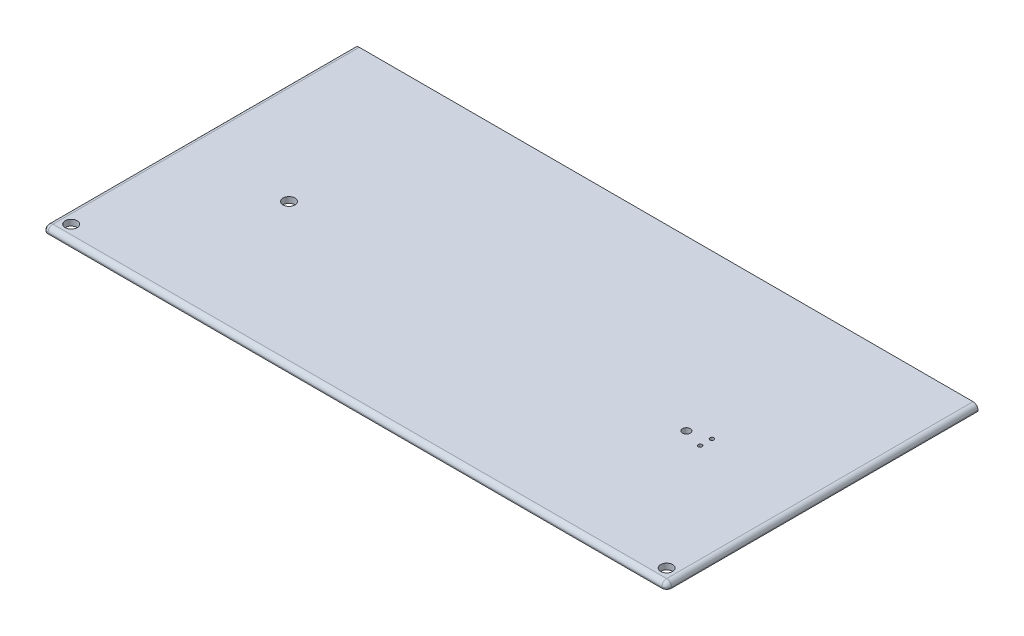
from build123d import *

# Parameters (mm, degrees)
BOSS_EXTRUDE1_DEPTH      = 1.25
SKETCH1_W                = 156
SKETCH1_H                = 69.5
BOSS_EXTRUDE2_DEPTH      = 105
SKETCH4_R                = 2.5000000000000027
BOSS_EXTRUDE3_DEPTH      = 8
FILLET2_R                = 2
SKETCH5_R                = 1.5499999999999998
SKETCH5_R_2              = 1.5500000000000012
CUT_EXTRUDE1_DEPTH       = 8
SKETCH6_R                = 8.25
CUT_EXTRUDE2_DEPTH       = 8
SKETCH8_R                = 3.750000000000007
SKETCH8_R_2              = 3.0000000000000084
SKETCH8_W                = 7.000000000000014
SKETCH8_H                = 14
CUT_EXTRUDE3_DEPTH       = 8
FILLET3_R                = 1.25
FILLET4_R                = 1.25
SKETCH11_R               = 1.5499999999999932
CUT_EXTRUDE4_DEPTH       = 8
BOSS_EXTRUDE5_REACH      = 209.004
FILLET5_R                = 1.25
SKETCH14_R               = 1.5249999999999995
CUT_EXTRUDE5_DEPTH       = 8
BOSS_EXTRUDE6_DEPTH      = 5
CUT_EXTRUDE10_DEPTH      = 176.50000000000017
CUT_EXTRUDE10_DEPTH_BACK = 9
SKETCH19_R               = 1.5249999999999995
BOSS_EXTRUDE7_DEPTH      = 1.5
SKETCH17_W               = 214.39373035957487
SKETCH17_H               = 311.75060194691184
CUT_EXTRUDE6_DEPTH       = 142.50000000000003
SKETCH18_W               = 843.8612520819788
SKETCH18_H               = 210.19069540658822
CUT_EXTRUDE7_DEPTH       = 211.50000000000009
FILLET6_R                = 1.25
SKETCH21_R               = 1.5249999999999995
CUT_EXTRUDE11_DEPTH      = 46.50000000000004
SKETCH22_R               = 1.5249999999999952
SKETCH22_R_2             = 0.49999999999999917
SKETCH22_R_3             = 0.9999999999999983
CUT_EXTRUDE12_DEPTH      = 46.50000000000004
SKETCH23_W               = 224.34927592813784
SKETCH23_H               = 20
CUT_EXTRUDE13_DEPTH      = 108.00000000000004
SKETCH24_W               = 191.54769742783472
SKETCH24_H               = 65.90413284325967
CUT_EXTRUDE14_DEPTH      = 151.00000000000006


with BuildPart() as part:
    # Sketch2 → Boss-Extrude1 (new body)
    with BuildSketch(Plane(origin=(0, 0, 0), x_dir=(1, 0, 0), z_dir=(0, 1, 0))):
        Polygon((-79.25000000000004, 35.99999999999998), (79.24999999999996, 35.99999999999999), (79.24999999999999, -159.00000000000003), (-79.25000000000001, -159.00000000000003), align=None)
    extrude(amount=-BOSS_EXTRUDE1_DEPTH)

    # Sketch1 → Boss-Extrude2 (add)
    with BuildSketch(Plane(origin=(0, 0, 0), x_dir=(1, 0, 0), z_dir=(0, 1, 0))):
        Polygon((79.24999999999999, -159.00000000000003), (-79.25000000000001, -159.00000000000003), (-79.25000000000004, -86.00000000000001), (-79.25000000000004, -36.00000000000002), (-79.25000000000004, 35.99999999999998), (79.24999999999996, 35.99999999999999), (79.24999999999996, -36.00000000000002), (79.24999999999996, -86.00000000000001), align=None)
        Polygon((-78.00000000000001, -157.75000000000006), (77.99999999999999, -157.75000000000006), (77.99999999999996, -86.00000000000001), (77.99999999999996, -36.00000000000002), (-78.00000000000004, -36.00000000000002), (-78.00000000000004, -86.00000000000001), (-78.00000000000004, -100.58859756900745), align=None, mode=Mode.SUBTRACT)
        Rectangle(SKETCH1_W, SKETCH1_H, mode=Mode.SUBTRACT)
    extrude(amount=BOSS_EXTRUDE2_DEPTH)

    # Sketch4 → Boss-Extrude3 (add)
    with BuildSketch(Plane(origin=(0, 0, 0), x_dir=(1, 0, 0), z_dir=(0, 1, 0))):
        with Locations(Location((-37.074999999999996, -117.75000000000004, 0), (0, 0, 90))):
            Circle(SKETCH4_R)
        with Locations(Location((37.074999999999996, -117.75000000000003, 0), (0, 0, 90))):
            Circle(SKETCH4_R)
    extrude(amount=BOSS_EXTRUDE3_DEPTH)

    # Fillet2
    fillet2_edges = [part.edges().sort_by_distance(p)[0] for p in [
        (77.99999999999996, 52.5, -34.749999999999986),
        (77.99999999999996, 52.5, 34.750000000000014),
        (-78.00000000000004, 0, 1.421e-14),
        (-78.00000000000004, 52.5, 34.750000000000014),
        (77.99999999999999, 52.5, 157.75000000000006),
        (-78.00000000000001, 52.5, 157.75000000000006),
        (-4.263e-14, 0, 36.00000000000002),
        (-78.00000000000004, 52.5, 36.00000000000002),
        (77.99999999999997, 0, 96.87500000000003),
        (77.99999999999996, 52.5, 36.00000000000002),
        (-4.263e-14, 0, -34.749999999999986),
        (-78.00000000000004, 52.5, -34.749999999999986),
        (-1.421e-14, 0, 157.75000000000006),
        (-78.00000000000003, 0, 96.87500000000004),
        (77.99999999999996, 0, 1.421e-14),
        (-4.263e-14, 0, 34.750000000000014),
        (-37.074999999999996, 0, 120.25000000000004),
        (37.074999999999996, 0, 120.25000000000003),
    ]]
    fillet(fillet2_edges, radius=FILLET2_R)

    # Sketch5 → Cut-Extrude1 (cut)
    with BuildSketch(Plane.XY.offset(36.00000000000002)):
        with BuildLine():
            ThreePointArc((-53.750000000000085, 99.54999999999998), (-54.84601551083924, 99.09601551083914), (-55.30000000000008, 97.99999999999999))
            Line((-55.30000000000008, 97.99999999999999), (-53.750000000000085, 97.99999999999999))
            Line((-53.750000000000085, 97.99999999999999), (-53.750000000000085, 99.54999999999998))
        make_face()
        with BuildLine():
            Line((-53.750000000000085, 97.99999999999999), (-55.30000000000008, 97.99999999999999))
            ThreePointArc((-55.30000000000008, 97.99999999999999), (-53.750000000000085, 96.44999999999999), (-52.20000000000009, 97.99999999999999))
            ThreePointArc((-52.20000000000009, 97.99999999999999), (-52.65398448916093, 99.09601551083914), (-53.750000000000085, 99.54999999999998))
            Line((-53.750000000000085, 99.54999999999998), (-53.750000000000085, 97.99999999999999))
        make_face()
        with Locations((53.750000000000206, 97.99999999999967)):
            Circle(SKETCH5_R)
        with Locations((-53.750000000000085, 7.999999999999743)):
            Circle(SKETCH5_R_2)
        with Locations((53.749999999999666, 7.9999999999994245)):
            Circle(SKETCH5_R_2)
    extrude(amount=-CUT_EXTRUDE1_DEPTH, mode=Mode.SUBTRACT)

    # Sketch6 → Cut-Extrude2 (cut)
    with BuildSketch(Plane(origin=(0, 0, 157.75000000000006), x_dir=(-1, 0, 0), z_dir=(0, 0, -1))):
        with Locations((0, 22)):
            Circle(SKETCH6_R)
    extrude(amount=-CUT_EXTRUDE2_DEPTH, mode=Mode.SUBTRACT)

    # Sketch8 → Cut-Extrude3 (cut)
    with BuildSketch(Plane.ZY.offset(79.25000000000004)):
        with Locations((131.5, 54.99999999999998)):
            Circle(SKETCH8_R)
        with Locations((101.50000000000001, 54.99999999999998)):
            Circle(SKETCH8_R_2)
        with Locations((116.50000000000003, 64.99999999999999)):
            Rectangle(SKETCH8_W, SKETCH8_H)
        with Locations((101.50000000000001, 64.99999999999997)):
            Circle(SKETCH8_R_2)
        with Locations((101.50000000000001, 74.99999999999997)):
            Circle(SKETCH8_R_2)
        with Locations((101.50000000000001, 84.99999999999997)):
            Circle(SKETCH8_R_2)
        with Locations((131.5, 74.99999999999999)):
            Circle(SKETCH8_R)
    extrude(amount=-CUT_EXTRUDE3_DEPTH, mode=Mode.SUBTRACT)

    # Fillet3
    fillet3_edges = [part.edges().sort_by_distance(p)[0] for p in [
        (79.24999999999997, -1.25, 61.50000000000002),
        (-4.263e-14, -1.25, -35.999999999999986),
        (-79.25000000000003, -1.25, 61.50000000000003),
        (-1.421e-14, -1.25, 159.00000000000003),
    ]]
    fillet(fillet3_edges, radius=FILLET3_R)

    # Fillet4
    # the kernel refuses this fillet: 1.25 mm, written as the material it takes off along each edge
    with BuildSketch(Plane(origin=(-78.00000000000004, 0, -34.74999999999997), x_dir=(-9e-17, 0, -1), z_dir=(-1, 0, 1.5e-16))) as fillet4_piece_1_section:
        Polygon((0, 0), (FILLET4_R, 0), (FILLET4_R, FILLET4_R), (0, FILLET4_R), align=None)
    fillet4_piece_1 = extrude(amount=FILLET4_R, mode=Mode.PRIVATE)
    fillet4_piece_1 = fillet4_piece_1 - Plane(origin=(-78.00000000000004, 0, -34.74999999999997), x_dir=(0, 0.7071067811865475, 0.7071067811865475), z_dir=(-1, 0, 1.5e-16)) * Sphere(FILLET4_R, mode=Mode.PRIVATE)
    add(fillet4_piece_1, mode=Mode.SUBTRACT)
    with BuildSketch(Plane(origin=(77.99999999999996, 0, -34.74999999999999), x_dir=(-9e-17, 0, -1), z_dir=(1, 0, -1.5e-16))) as fillet4_piece_2_section:
        Polygon((0, 0), (FILLET4_R, 0), (FILLET4_R, -FILLET4_R), (0, -FILLET4_R), align=None)
    fillet4_piece_2 = extrude(amount=FILLET4_R, mode=Mode.PRIVATE)
    fillet4_piece_2 = fillet4_piece_2 - Plane(origin=(77.99999999999996, 0, -34.74999999999999), x_dir=(0, 0.7071067811865475, 0.7071067811865475), z_dir=(1, 0, -1.5e-16)) * Sphere(FILLET4_R, mode=Mode.PRIVATE)
    add(fillet4_piece_2, mode=Mode.SUBTRACT)
    with BuildSketch(Plane(origin=(-78.00000000000001, 0, 157.75000000000003), x_dir=(-1, 0, 1.5e-16), z_dir=(0, 0, 1))) as fillet4_piece_3_section:
        Polygon((0, 0), (FILLET4_R, 0), (FILLET4_R, FILLET4_R), (0, FILLET4_R), align=None)
    fillet4_piece_3 = extrude(amount=FILLET4_R, mode=Mode.PRIVATE)
    fillet4_piece_3 = fillet4_piece_3 - Plane(origin=(-78.00000000000001, 0, 157.75000000000003), x_dir=(0.7071067811865475, 0.7071067811865475, 0), z_dir=(0, 0, 1)) * Sphere(FILLET4_R, mode=Mode.PRIVATE)
    add(fillet4_piece_3, mode=Mode.SUBTRACT)
    with BuildSketch(Plane(origin=(77.99999999999999, 0, 157.75000000000003), x_dir=(1, 0, -1.5e-16), z_dir=(0, 0, 1))) as fillet4_piece_4_section:
        Polygon((0, 0), (FILLET4_R, 0), (FILLET4_R, -FILLET4_R), (0, -FILLET4_R), align=None)
    fillet4_piece_4 = extrude(amount=FILLET4_R, mode=Mode.PRIVATE)
    fillet4_piece_4 = fillet4_piece_4 - Plane(origin=(77.99999999999999, 0, 157.75000000000003), x_dir=(-0.7071067811865475, 0.7071067811865475, 0), z_dir=(0, 0, 1)) * Sphere(FILLET4_R, mode=Mode.PRIVATE)
    add(fillet4_piece_4, mode=Mode.SUBTRACT)
    with BuildSketch(Plane(origin=(79.24999999999999, 108.12500000000007, 159.00000000000003), x_dir=(-1, 0, 0), z_dir=(0, -1, 0))) as fillet4_piece_5:
        with BuildLine():
            CenterArc((FILLET4_R, FILLET4_R), FILLET4_R, 179.9999999999987, 90.00000000000131)
            Line((0, FILLET4_R), (0, 0))
            Line((0, 0), (FILLET4_R, 0))
        make_face()
    extrude(amount=108.12500000000007, mode=Mode.SUBTRACT)
    with BuildSketch(Plane(origin=(-79.25000000000001, -2.2e-16, 159.00000000000003), x_dir=(1, 0, 0), z_dir=(0, 1, 0))) as fillet4_piece_6:
        with BuildLine():
            CenterArc((FILLET4_R, FILLET4_R), FILLET4_R, 180, 90)
            Line((0, FILLET4_R), (0, 0))
            Line((0, 0), (FILLET4_R, 0))
        make_face()
    extrude(amount=108.12499999999999, mode=Mode.SUBTRACT)
    with BuildSketch(Plane(origin=(79.24999999999996, 108.125, -35.99999999999999), x_dir=(0, 0, 1), z_dir=(0, -1, 0))) as fillet4_piece_7:
        with BuildLine():
            CenterArc((FILLET4_R, FILLET4_R), FILLET4_R, 180, 90)
            Line((0, FILLET4_R), (0, 0))
            Line((0, 0), (FILLET4_R, 0))
        make_face()
    extrude(amount=108.125, mode=Mode.SUBTRACT)
    with BuildSketch(Plane(origin=(-79.25000000000004, -2.2e-16, -35.99999999999998), x_dir=(0, 0, 1), z_dir=(0, 1, 0))) as fillet4_piece_8:
        with BuildLine():
            CenterArc((FILLET4_R, FILLET4_R), FILLET4_R, 180, 90)
            Line((-2.132e-14, FILLET4_R), (0, 0))
            Line((0, 0), (FILLET4_R, 0))
        make_face()
    extrude(amount=108.12499999999999, mode=Mode.SUBTRACT)

    # Sketch11 → Cut-Extrude4 (cut)
    with BuildSketch(Plane(origin=(79.24999999999996, 0, -1.128e-14), x_dir=(-1.4e-16, 0, -1), z_dir=(1, 0, -1.4e-16))):
        with BuildLine():
            ThreePointArc((-13.05000000000001, 102.49999999999999), (-12.596015510839159, 101.40398448916083), (-11.50000000000001, 100.94999999999999))
            Line((-11.50000000000001, 100.94999999999999), (-11.50000000000001, 102.49999999999999))
            Line((-11.500000000000014, 102.49999999999999), (-13.050000000000011, 102.49999999999999))
        make_face()
        with BuildLine():
            Line((-11.50000000000001, 102.49999999999999), (-11.50000000000001, 100.94999999999999))
            ThreePointArc((-11.50000000000001, 100.94999999999999), (-10.403984489160864, 101.40398448916083), (-9.950000000000012, 102.49999999999999))
            ThreePointArc((-9.950000000000012, 102.49999999999999), (-11.50000000000001, 104.04999999999998), (-13.05000000000001, 102.49999999999999))
            Line((-13.050000000000011, 102.49999999999999), (-11.500000000000014, 102.49999999999999))
        make_face()
        with BuildLine():
            ThreePointArc((-25.550000000000008, 90), (-25.096015510839155, 88.90398448916085), (-24.000000000000007, 88.45))
            Line((-24.000000000000007, 88.45000000000002), (-24.000000000000007, 90))
            Line((-24, 90), (-25.55000000000001, 90))
        make_face()
        with BuildLine():
            Line((-24.000000000000007, 90), (-24.000000000000007, 88.45000000000002))
            ThreePointArc((-24.000000000000007, 88.45), (-22.90398448916086, 88.90398448916085), (-22.450000000000006, 90))
            ThreePointArc((-22.450000000000006, 90), (-24.000000000000007, 91.55), (-25.550000000000008, 90))
            Line((-25.55000000000001, 90), (-24, 90))
        make_face()
        with BuildLine():
            ThreePointArc((-9.949999999999998, 2.4999999999999742), (-10.403984489160848, 3.5960155108391216), (-11.499999999999995, 4.049999999999974))
            Line((-11.499999999999996, 4.049999999999969), (-11.499999999999996, 2.4999999999999716))
            Line((-11.5, 2.4999999999999742), (-13.049999999999997, 2.4999999999999742))
            ThreePointArc((-13.049999999999995, 2.4999999999999742), (-11.499999999999996, 0.9499999999999749), (-9.949999999999998, 2.499999999999974))
        make_face()
        with BuildLine():
            Line((-11.499999999999996, 2.4999999999999716), (-11.499999999999996, 4.049999999999969))
            ThreePointArc((-11.499999999999995, 4.049999999999974), (-12.596015510839145, 3.596015510839123), (-13.049999999999995, 2.4999999999999742))
            Line((-13.049999999999997, 2.4999999999999742), (-11.5, 2.4999999999999742))
        make_face()
        with BuildLine():
            ThreePointArc((-111.5, 4.049999999999969), (-112.59601551083915, 1.40398448916083), (-109.95, 2.499999999999974))
            Line((-109.95, 2.4999999999999742), (-111.5, 2.4999999999999742))
            Line((-111.5, 2.4999999999999716), (-111.5, 4.049999999999969))
        make_face()
        with BuildLine():
            Line((-111.5, 2.4999999999999742), (-109.95, 2.4999999999999742))
            ThreePointArc((-109.95, 2.4999999999999742), (-110.40398448916086, 3.5960155108391185), (-111.5, 4.049999999999969))
            Line((-111.5, 4.049999999999969), (-111.5, 2.4999999999999716))
        make_face()
        with BuildLine():
            ThreePointArc((-97.45, 14.999999999999993), (-97.90398448916086, 16.096015510839138), (-99, 16.549999999999986))
            Line((-99, 16.549999999999986), (-99, 14.999999999999993))
            Line((-99, 14.999999999999993), (-97.45, 14.999999999999993))
        make_face()
        with BuildLine():
            Line((-99, 14.999999999999993), (-99, 16.549999999999986))
            ThreePointArc((-99, 16.549999999999986), (-100.09601551083915, 13.903984489160848), (-97.45, 14.999999999999993))
            Line((-97.45, 14.999999999999993), (-99, 14.999999999999993))
        make_face()
        with BuildLine():
            ThreePointArc((-22.450000000000006, 14.999999999999993), (-22.90398448916086, 16.09601551083914), (-24.000000000000007, 16.549999999999994))
            Line((-24.000000000000007, 16.549999999999994), (-24.000000000000007, 14.999999999999993))
            Line((-24, 14.999999999999993), (-25.55000000000001, 14.999999999999993))
            ThreePointArc((-25.550000000000008, 14.999999999999993), (-24.000000000000007, 13.449999999999992), (-22.450000000000006, 14.999999999999993))
        make_face()
        with BuildLine():
            Line((-24.000000000000007, 14.999999999999993), (-24.000000000000007, 16.549999999999994))
            ThreePointArc((-24.000000000000007, 16.549999999999994), (-25.096015510839155, 16.09601551083914), (-25.550000000000008, 14.999999999999993))
            Line((-25.55000000000001, 14.999999999999993), (-24, 14.999999999999993))
        make_face()
        with Locations((-111.50000000000001, 102.49999999999999)):
            Circle(SKETCH11_R)
        with Locations((-99, 90)):
            Circle(SKETCH11_R)
    extrude(amount=-CUT_EXTRUDE4_DEPTH, mode=Mode.SUBTRACT)

    # Boss-Extrude5: up to this face of the body (flat: up to its plane)
    boss_extrude5_end = Plane(part.part.faces().sort_by_distance((0, 0, 96.725539908))[0])
    # Sketch12 → Boss-Extrude5 (add, up to the picked face)
    with BuildSketch(Plane(origin=(0, 105, 0), x_dir=(1, 0, 0), z_dir=(0, 1, 0)), mode=Mode.PRIVATE) as boss_extrude5_sk1:
        with BuildLine():
            Line((73, -152.75000000000043), (72.99999999999997, -157.75000000000043))
            Line((72.99999999999997, -157.75000000000043), (75.99999999999996, -157.75000000000045))
            ThreePointArc((75.99999999999996, -157.75000000000006), (77.41421356237305, -157.16421356237316), (77.99999999999994, -155.75000000000006))
            Line((77.99999999999999, -155.75000000000006), (78, -152.75000000000045))
            Line((78, -152.75000000000045), (73, -152.75000000000043))
        make_face()
    boss_extrude5_tool1 = split(extrude(boss_extrude5_sk1.sketch, amount=-BOSS_EXTRUDE5_REACH, mode=Mode.PRIVATE), bisect_by=boss_extrude5_end, keep=Keep.BOTH, mode=Mode.PRIVATE)
    # Sketch12 → Boss-Extrude5 (add, up to the picked face)
    with BuildSketch(Plane(origin=(0, 105, 0), x_dir=(1, 0, 0), z_dir=(0, 1, 0)), mode=Mode.PRIVATE) as boss_extrude5_sk2:
        with BuildLine():
            ThreePointArc((-78.00000000000003, -155.75000000000006), (-77.41421356237313, -157.16421356237316), (-76.00000000000003, -157.75000000000006))
            Line((-76.00000000000003, -157.75000000000006), (-73.00000000000003, -157.75000000000006))
            Line((-73.00000000000003, -157.75000000000006), (-73.00000000000003, -152.75000000000006))
            Line((-73.00000000000003, -152.75000000000006), (-78.00000000000003, -152.75000000000006))
            Line((-78.00000000000003, -152.75000000000006), (-78.00000000000003, -155.75000000000006))
        make_face()
    boss_extrude5_tool2 = split(extrude(boss_extrude5_sk2.sketch, amount=-BOSS_EXTRUDE5_REACH, mode=Mode.PRIVATE), bisect_by=boss_extrude5_end, keep=Keep.BOTH, mode=Mode.PRIVATE)
    add(boss_extrude5_tool1.solids().sort_by(Axis((75.426992, 105, 155.176992), (0, -1, 0)))[0])
    add(boss_extrude5_tool2.solids().sort_by(Axis((-75.426992, 105, 155.176992), (0, -1, 0)))[0])

    # Fillet5
    fillet5_edges = [part.edges().sort_by_distance(p)[0] for p in [
        (77.41421356237306, 0.5857864376269042, 152.75000000000043),
        (72.99999999999999, 0.5857864376269046, 157.16421356237316),
        (72.99999999999997, 53.5, 157.75000000000043),
        (74.49999999999999, 0, 152.75000000000043),
        (73, 52.5, 152.75000000000043),
        (78, 53.5, 152.75000000000045),
        (73, 0, 154.25000000000023),
        (-77.41421356237313, 0.5857864376269042, 152.75000000000006),
        (-73.00000000000003, 0, 154.25000000000006),
        (-73.00000000000003, 52.5, 152.75000000000006),
        (-78.00000000000003, 53.5, 152.75000000000006),
        (-74.50000000000003, 0, 152.75000000000006),
        (-73.00000000000003, 0.5857864376269046, 157.16421356237316),
        (-73.00000000000003, 53.5, 157.75000000000006),
    ]]
    fillet(fillet5_edges, radius=FILLET5_R)

    # Sketch14 → Cut-Extrude5 (cut)
    with BuildSketch(Plane(origin=(0, 105, 0), x_dir=(1, 0, 0), z_dir=(0, 1, 0))):
        with Locations(Location((75.68305826175839, -155.43305826175865, 0), (0, 0, 270))):
            Circle(SKETCH14_R)
        with Locations(Location((-75.68305826175845, -155.43305826175828, 0), (0, 0, 270))):
            Circle(SKETCH14_R)
    extrude(amount=-CUT_EXTRUDE5_DEPTH, mode=Mode.SUBTRACT)

    # Sketch19 → Cut-Extrude10 (cut, two sides: drawn at the far end of the back side and taken through both)
    with BuildSketch(Plane(origin=(0, 105, 0), x_dir=(1, 0, 0), z_dir=(0, 1, 0)).offset(-CUT_EXTRUDE10_DEPTH_BACK)):
        with Locations(Location((75.68305826175839, -155.43305826175865, 0), (0, 0, 270))):
            Circle(SKETCH19_R)
        with Locations(Location((-75.68305826175845, -155.43305826175828, 0), (0, 0, 270))):
            Circle(SKETCH19_R)
    extrude(amount=CUT_EXTRUDE10_DEPTH + CUT_EXTRUDE10_DEPTH_BACK, mode=Mode.SUBTRACT)



with BuildPart() as body_2:
    # Sketch15 → Boss-Extrude6 (new body)
    with BuildSketch(Plane(origin=(0, 105, 0), x_dir=(1, 0, 0), z_dir=(0, 1, 0))):
        with BuildLine():
            Line((-77.50000000000004, 32.749999999999986), (-77.50000000000004, -32.750000000000014))
            ThreePointArc((-77.50000000000004, -32.750000000000014), (-77.06066017177986, -33.81066017177984), (-76.00000000000004, -34.250000000000014))
            Line((-76.00000000000004, -34.250000000000014), (75.99999999999996, -34.250000000000014))
            ThreePointArc((75.99999999999996, -34.250000000000014), (77.06066017177977, -33.81066017177984), (77.49999999999996, -32.750000000000014))
            Line((77.49999999999996, -32.750000000000014), (77.49999999999996, 32.749999999999986))
            ThreePointArc((77.49999999999996, 32.749999999999986), (77.06066017177977, 33.81066017177981), (75.99999999999996, 34.249999999999986))
            Line((75.99999999999996, 34.249999999999986), (-76.00000000000004, 34.249999999999986))
            ThreePointArc((-76.00000000000004, 34.249999999999986), (-77.06066017177986, 33.81066017177981), (-77.50000000000004, 32.749999999999986))
        make_face()
        with BuildLine():
            Line((75.99999999999996, 32.999999999999986), (-76.00000000000004, 32.999999999999986))
            ThreePointArc((-76.00000000000004, 32.999999999999986), (-76.17677669529668, 32.926776695296624), (-76.25000000000004, 32.749999999999986))
            Line((-76.25000000000004, 32.749999999999986), (-76.25000000000004, -32.750000000000014))
            ThreePointArc((-76.25000000000004, -32.750000000000014), (-76.17677669529668, -32.92677669529665), (-76.00000000000004, -33.000000000000014))
            Line((-76.00000000000004, -33.000000000000014), (75.99999999999996, -33.000000000000014))
            ThreePointArc((75.99999999999996, -33.000000000000014), (76.1767766952966, -32.92677669529665), (76.24999999999996, -32.750000000000014))
            Line((76.24999999999996, -32.750000000000014), (76.24999999999996, 32.749999999999986))
            ThreePointArc((76.24999999999996, 32.749999999999986), (76.1767766952966, 32.926776695296624), (75.99999999999996, 32.999999999999986))
        make_face(mode=Mode.SUBTRACT)
    extrude(amount=-BOSS_EXTRUDE6_DEPTH)


with BuildPart() as part_1:
    add(part.part)

    add(body_2.part)  # Boss-Extrude7 merges body 2
    # Sketch16 → Boss-Extrude7 (add)
    with BuildSketch(Plane(origin=(0, 105, 0), x_dir=(1, 0, 0), z_dir=(0, 1, 0))):
        with BuildLine():
            Line((-79.25000000000004, 34.74999999999998), (-79.25000000000004, -157.75000000000003))
            ThreePointArc((-79.25000000000004, -157.75000000000003), (-78.88388347648322, -158.63388347648322), (-78.00000000000001, -159.00000000000003))
            Line((-78.00000000000001, -159.00000000000003), (77.99999999999999, -159.00000000000003))
            ThreePointArc((77.99999999999999, -159.00000000000003), (78.88388347648316, -158.63388347648322), (79.24999999999999, -157.75000000000003))
            Line((79.24999999999999, -157.75000000000003), (79.24999999999991, 34.749999999999986))
            ThreePointArc((79.24999999999991, 34.749999999999986), (78.8838834764831, 35.63388347648314), (77.99999999999996, 35.99999999999997))
            Line((77.99999999999996, 35.99999999999997), (-78.00000000000004, 35.99999999999998))
            ThreePointArc((-78.00000000000004, 35.99999999999998), (-78.88388347648322, 35.63388347648316), (-79.25000000000004, 34.74999999999998))
        make_face()
    extrude(amount=BOSS_EXTRUDE7_DEPTH)

    # Sketch17 → Cut-Extrude6 (cut)
    with BuildSketch(Plane.XZ.offset(-105)):
        with Locations((-9.695908791144348, 54.3605461890202)):
            Rectangle(SKETCH17_W, SKETCH17_H)
        with BuildLine():
            Line((77.99999999999996, -32.749999999999986), (77.99999999999996, 32.750000000000014))
            ThreePointArc((77.99999999999996, 32.750000000000014), (77.41421356237305, 34.16421356237311), (75.99999999999996, 34.750000000000014))
            Line((75.99999999999996, 34.750000000000014), (-76.00000000000004, 34.750000000000014))
            ThreePointArc((-76.00000000000004, 34.750000000000014), (-77.41421356237313, 34.16421356237311), (-78.00000000000004, 32.750000000000014))
            Line((-78.00000000000004, 32.750000000000014), (-78.00000000000004, -32.749999999999986))
            ThreePointArc((-78.00000000000004, -32.749999999999986), (-77.41421356237313, -34.16421356237308), (-76.00000000000004, -34.749999999999986))
            Line((-76.00000000000004, -34.749999999999986), (75.99999999999996, -34.749999999999986))
            ThreePointArc((75.99999999999996, -34.749999999999986), (77.41421356237305, -34.16421356237308), (77.99999999999996, -32.749999999999986))
        make_face(mode=Mode.SUBTRACT)
    extrude(amount=CUT_EXTRUDE6_DEPTH, mode=Mode.SUBTRACT)


with BuildPart() as cut_extrude6_piece_1:
    # of the separate pieces the step leaves, piece 1, a body of its own (cut_extrude6_pieces)
    add(part_1.part.solids().sort_by_distance((-76, 105, -34.25))[0])

    # Fillet6
    fillet6_edges = [cut_extrude6_piece_1.edges().sort_by_distance(p)[0] for p in [
        (-78.88388347648322, 106.5, -35.633883476483156),
        (-79.25000000000004, 106.5, 61.50000000000002),
        (-78.88388347648322, 106.5, 158.63388347648322),
        (-1.421e-14, 106.5, 159.00000000000003),
        (78.88388347648318, 106.5, 158.63388347648322),
        (79.24999999999994, 106.5, 61.50000000000003),
        (78.8838834764831, 106.5, -35.63388347648314),
        (-4.263e-14, 106.5, -35.99999999999997),
    ]]
    fillet(fillet6_edges, radius=FILLET6_R)

    # Sketch21 → Cut-Extrude11 (cut)
    with BuildSketch(Plane(origin=(0, 106.5, 0), x_dir=(1, 0, 0), z_dir=(0, 1, 0))):
        with Locations(Location((-75.68068975770814, -155.43068975770817, 0), (0, 0, 270))):
            Circle(SKETCH21_R)
        with Locations(Location((75.68068975770811, -155.43068975770834, 0), (0, 0, 270))):
            Circle(SKETCH21_R)
    extrude(amount=-CUT_EXTRUDE11_DEPTH, mode=Mode.SUBTRACT)

    # Sketch22 → Cut-Extrude12 (cut)
    with BuildSketch(Plane(origin=(0, 106.5, 0), x_dir=(1, 0, 0), z_dir=(0, 1, 0))):
        with Locations(Location((-53.000000000000014, -122.75000000000003, 0), (0, 0, 270))):
            Circle(SKETCH22_R)
        with Locations(Location((53.000000000000014, -121.25000000000003, 0), (0, 0, 270))):
            Circle(SKETCH22_R_2)
        with Locations(Location((53.000000000000014, -124.25000000000003, 0), (0, 0, 270))):
            Circle(SKETCH22_R_2)
        with Locations(Location((48.000000000000014, -122.75000000000003, 0), (0, 0, 270))):
            Circle(SKETCH22_R_3)
    extrude(amount=-CUT_EXTRUDE12_DEPTH, mode=Mode.SUBTRACT)

    # Sketch23 → Cut-Extrude13 (cut)
    with BuildSketch(Plane.XZ.offset(-105)):
        with Locations((5.748765940339929, 69.87855319631414)):
            Rectangle(SKETCH23_W, SKETCH23_H)
    extrude(amount=-CUT_EXTRUDE13_DEPTH, mode=Mode.SUBTRACT)


with BuildPart() as cut_extrude6_piece_2:
    # of the separate pieces the step leaves, piece 2, a body of its own (cut_extrude6_pieces)
    add(part_1.part.solids().sort_by_distance((-78, 2, -32.75))[0])

    # Sketch18 → Cut-Extrude7 (cut)
    with BuildSketch(Plane.XZ.offset(-99.99999999999999)):
        Rectangle(SKETCH18_W, SKETCH18_H)
    extrude(amount=CUT_EXTRUDE7_DEPTH, mode=Mode.SUBTRACT)


with BuildPart() as cut_extrude13_piece_1:
    # of the separate pieces the step leaves, piece 1, a body of its own (cut_extrude13_pieces)
    add(cut_extrude6_piece_1.part.solids().sort_by_distance((-79.25, 105, 59.878553196))[0])

    # Sketch24 → Cut-Extrude14 (cut)
    with BuildSketch(Plane.XY.offset(59.87855319631415)):
        with Locations((-2.9102395598225, 105.25)):
            Rectangle(SKETCH24_W, SKETCH24_H)
    extrude(amount=-CUT_EXTRUDE14_DEPTH, mode=Mode.SUBTRACT)


with BuildPart() as cut_extrude13_piece_2:
    # of the separate pieces the step leaves, piece 2, a body of its own (cut_extrude13_pieces)
    add(cut_extrude6_piece_1.part.solids().sort_by_distance((-78, 105.25, 159))[0])


solid = cut_extrude13_piece_2.part
